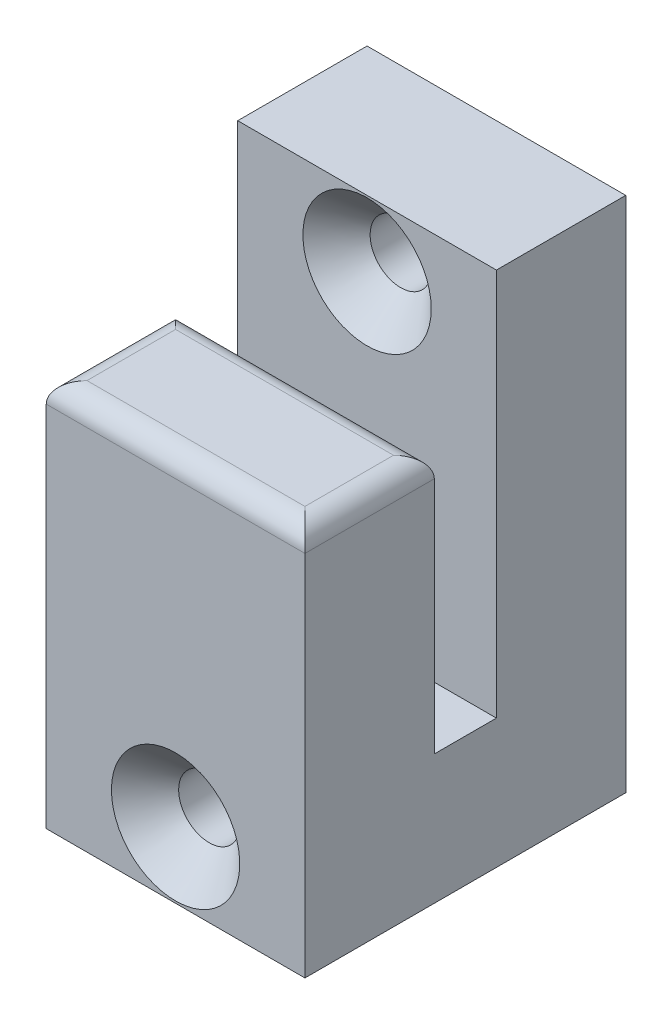
from build123d import *

# Parameters (mm, degrees)
BOSS_EXTRUDE1_DEPTH = 25.4
SKETCH2_R           = 3
CUT_EXTRUDE1_DEPTH  = 50.800280714
CHAMFER1_SIZE       = 3.3
FILLET1_R           = 2


with BuildPart() as part:
    # Sketch1 → Boss-Extrude1 (new body)
    with BuildSketch(Plane(origin=(0, 0, 0), x_dir=(0, 0, -1), z_dir=(1, 0, 0))):
        Polygon((-0.8, 16.328571429), (-13.5, 16.328571429), (-13.5, -21.771428571), (18, -21.771428571), (18, 29.028571429), (5.3, 29.028571429), (5.3, -9.071428571), (-0.8, -9.071428571), align=None)
    extrude(amount=BOSS_EXTRUDE1_DEPTH)

    # Sketch2 → Cut-Extrude1 (cut, through all)
    with BuildSketch(Plane(origin=(0, 0, -18), x_dir=(-1, 0, 0), z_dir=(0, 0, -1))):
        with Locations((-12.7, 22.528571429)):
            Circle(SKETCH2_R)
        with Locations((-12.7, -15.271428571)):
            Circle(SKETCH2_R)
    extrude(amount=-CUT_EXTRUDE1_DEPTH, mode=Mode.SUBTRACT)

    # Chamfer1
    chamfer1_edges = [part.edges().sort_by_distance(p)[0] for p in [
        (15.7, -15.271428571, 13.5),
        (15.7, 22.528571429, -5.3),
    ]]
    chamfer(chamfer1_edges, length=CHAMFER1_SIZE)

    # Fillet1
    fillet1_edges = [part.edges().sort_by_distance(p)[0] for p in [
        (12.7, 16.328571429, 0.8),
        (25.4, 16.328571429, 7.15),
        (12.7, 16.328571429, 13.5),
        (0, 16.328571429, 7.15),
    ]]
    fillet(fillet1_edges, radius=FILLET1_R)


solid = part.part
